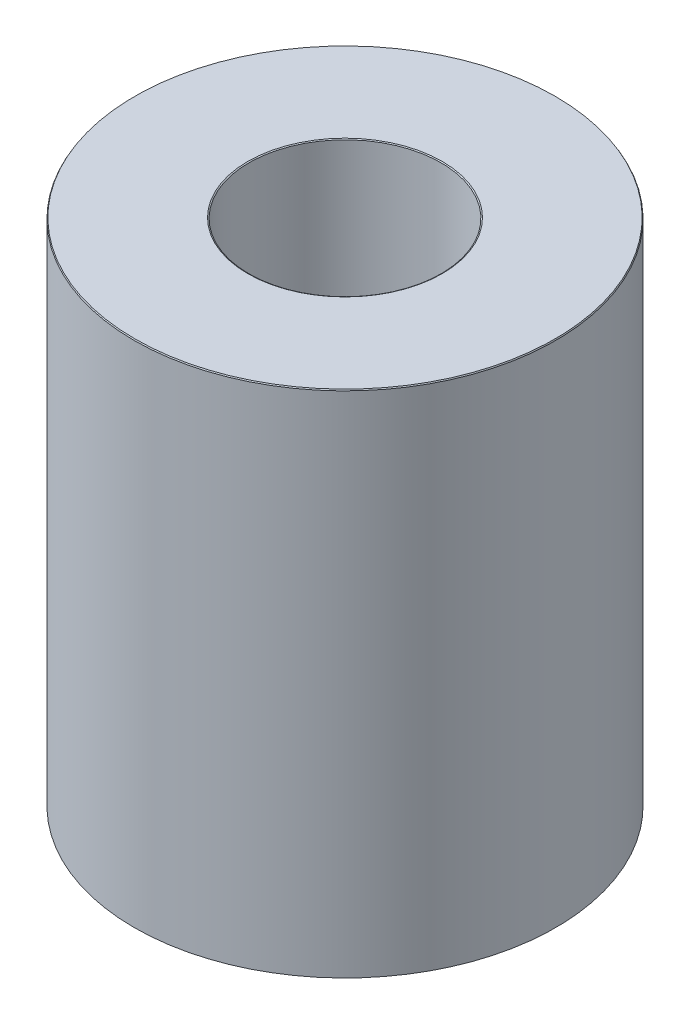
from build123d import *
from OCP.BRepFilletAPI import BRepFilletAPI_MakeChamfer

# Parameters (mm, degrees)
SKETCH1_R           = 45
BOSS_EXTRUDE1_DEPTH = 108.928816676
SKETCH2_R           = 20.525455255
CUT_EXTRUDE1_DEPTH  = 127.156597538
CHAMFER1_SIZE       = 0.2332202
CHAMFER1_SIZE2      = 0.134649745


with BuildPart() as part:
    # Sketch1 → Boss-Extrude1 (new body)
    with BuildSketch(Plane(origin=(0, 0, 0), x_dir=(1, 0, 0), z_dir=(0, 1, 0))):
        Circle(SKETCH1_R)
    extrude(amount=BOSS_EXTRUDE1_DEPTH)

    # Sketch2 → Cut-Extrude1 (cut, through all)
    with BuildSketch(Plane(origin=(0, 0, 0), x_dir=(1, 0, 0), z_dir=(0, 1, 0))):
        Circle(SKETCH2_R)
    extrude(amount=CUT_EXTRUDE1_DEPTH, mode=Mode.SUBTRACT)

    # Chamfer1: one chamfer whose edges measure the first distance from different faces: ONE call of the kernel's chamfer builder (chamfer() names one face for all edges)
    chamfer1_edges_1 = [part.edges().sort_by_distance(p)[0] for p in [
        (-20.525455255, 108.928816676, 0),
    ]]
    chamfer1_side_1 = [part.faces().sort_by_distance(p)[0] for p in [
        (-43.727207794, 108.928816676, 0),
    ]]
    chamfer1_edges_2 = [part.edges().sort_by_distance(p)[0] for p in [
        (-20.525455255, 0, 0),
    ]]
    chamfer1_side_2 = [part.faces().sort_by_distance(p)[0] for p in [
        (-20.525455255, 54.464408338, 0),
    ]]
    chamfer1_edges_3 = [part.edges().sort_by_distance(p)[0] for p in [
        (-45, 0, 0),
    ]]
    chamfer1_side_3 = [part.faces().sort_by_distance(p)[0] for p in [
        (-43.727207794, 0, 0),
    ]]
    chamfer1_edges_4 = [part.edges().sort_by_distance(p)[0] for p in [
        (-45, 108.928816676, 0),
    ]]
    chamfer1_side_4 = [part.faces().sort_by_distance(p)[0] for p in [
        (-45, 54.464408338, 0),
    ]]
    chamfer1 = BRepFilletAPI_MakeChamfer(part.part.solid().wrapped)
    for e in chamfer1_edges_1:
        chamfer1.Add(CHAMFER1_SIZE, CHAMFER1_SIZE2, e.wrapped, chamfer1_side_1[0].wrapped)  # the first distance lies on this face
    for e in chamfer1_edges_2:
        chamfer1.Add(CHAMFER1_SIZE, CHAMFER1_SIZE2, e.wrapped, chamfer1_side_2[0].wrapped)  # the first distance lies on this face
    for e in chamfer1_edges_3:
        chamfer1.Add(CHAMFER1_SIZE, CHAMFER1_SIZE2, e.wrapped, chamfer1_side_3[0].wrapped)  # the first distance lies on this face
    for e in chamfer1_edges_4:
        chamfer1.Add(CHAMFER1_SIZE, CHAMFER1_SIZE2, e.wrapped, chamfer1_side_4[0].wrapped)  # the first distance lies on this face
    add(Compound.cast(chamfer1.Shape()), mode=Mode.REPLACE)


solid = part.part
